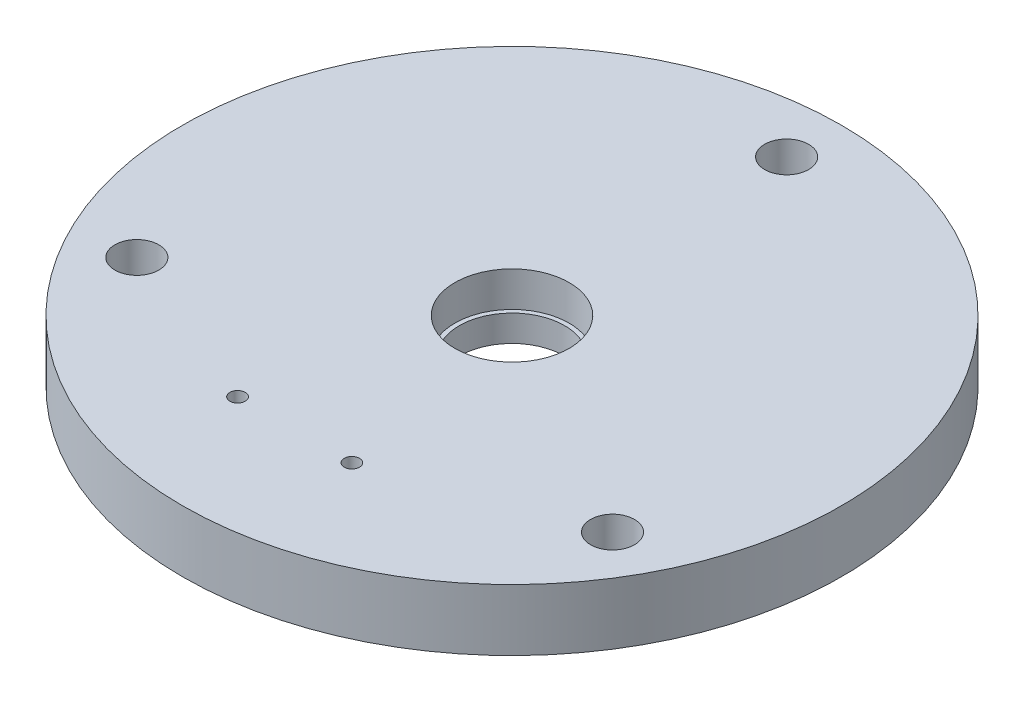
from build123d import *

# Parameters (mm, degrees)
SKETCH1_R           = 75
BOSS_EXTRUDE1_DEPTH = 14
SKETCH2_R           = 13
CUT_EXTRUDE1_DEPTH  = 8
SKETCH3_R           = 12
CUT_EXTRUDE2_DEPTH  = 8
SKETCH4_R           = 5
CUT_EXTRUDE4_DEPTH  = 107.98598039
SKETCH5_R           = 1.75
CUT_EXTRUDE5_DEPTH  = 107.98598039


with BuildPart() as part:
    # Sketch1 → Boss-Extrude1 (new body)
    with BuildSketch(Plane(origin=(0, 0, 0), x_dir=(1, 0, 0), z_dir=(0, 1, 0))):
        Circle(SKETCH1_R)
    extrude(amount=BOSS_EXTRUDE1_DEPTH)

    # Sketch2 → Cut-Extrude1 (cut)
    with BuildSketch(Plane(origin=(0, 14, 0), x_dir=(1, 0, 0), z_dir=(0, 1, 0))):
        Circle(SKETCH2_R)
    extrude(amount=-CUT_EXTRUDE1_DEPTH, mode=Mode.SUBTRACT)

    # Sketch3 → Cut-Extrude2 (cut)
    with BuildSketch(Plane(origin=(0, 6, 0), x_dir=(1, 0, 0), z_dir=(0, 1, 0))):
        Circle(SKETCH3_R)
    extrude(amount=-CUT_EXTRUDE2_DEPTH, mode=Mode.SUBTRACT)

    # Sketch4 → Cut-Extrude4 (cut, through all)
    with BuildSketch(Plane(origin=(0, 14, 0), x_dir=(1, 0, 0), z_dir=(0, 1, 0))):
        with Locations((0, 62.5)):
            Circle(SKETCH4_R)
        with Locations((-54.126587737, -31.25)):
            Circle(SKETCH4_R)
        with Locations((54.126587737, -31.25)):
            Circle(SKETCH4_R)
    extrude(amount=-CUT_EXTRUDE4_DEPTH, mode=Mode.SUBTRACT)

    # Sketch5 → Cut-Extrude5 (cut, through all)
    with BuildSketch(Plane(origin=(0, 14, 0), x_dir=(1, 0, 0), z_dir=(0, 1, 0))):
        with Locations((-15.201634245, -47.250661584)):
            Circle(SKETCH5_R)
        with Locations((10.798365755, -47.250661584)):
            Circle(SKETCH5_R)
    extrude(amount=-CUT_EXTRUDE5_DEPTH, mode=Mode.SUBTRACT)


solid = part.part
